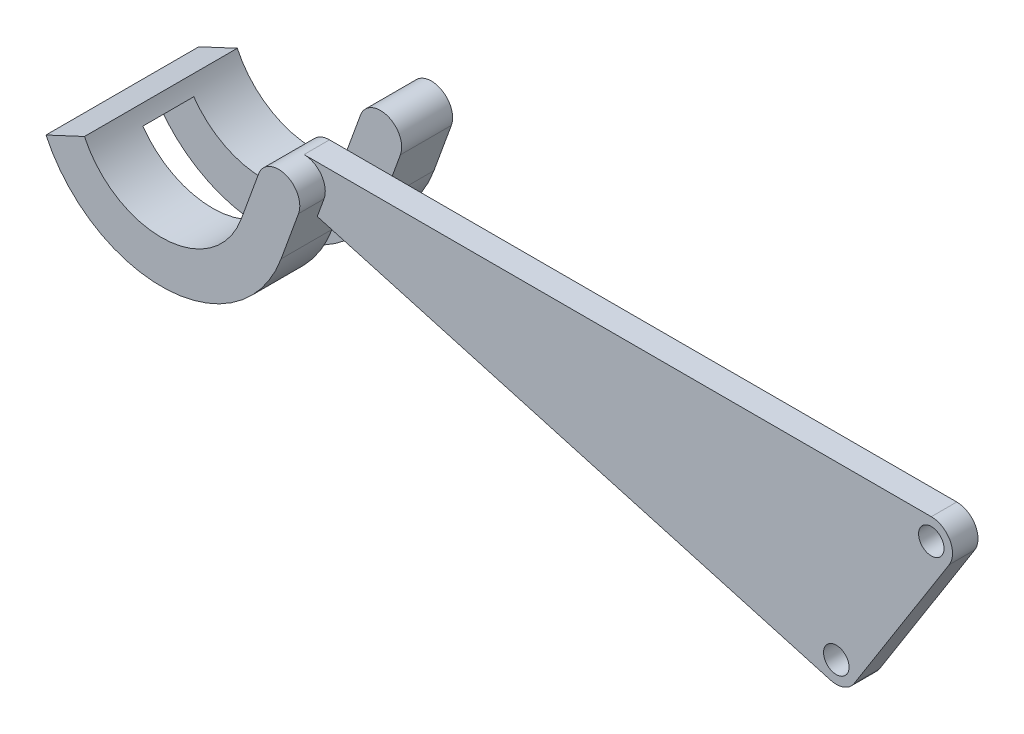
from build123d import *

# Parameters (mm, degrees)
EXTRUDE_1_DEPTH      = 0.75
SKETCH_2_R           = 0.75
CUT_EXTRUDE_1_DEPTH  = 11.5
EXTRUDE_2_DEPTH      = 6
EXTRUDE_2_DEPTH_BACK = 3
CUT_EXTRUDE_2_DEPTH  = 3


with BuildPart() as part:
    # 草圖1 → 填料-伸長1 (new, symmetric)
    with BuildSketch(Plane.XY):
        with BuildLine():
            Line((0, 1.25), (36.94, 1.25))
            ThreePointArc((36.94, 1.25), (38.034878383, 0.603109713), (37.99653086, -0.668013878))
            Line((37.99653086, -0.668013878), (32.401246615, -9.517516363))
            ThreePointArc((32.401246615, -9.517516363), (31.791964157, -10.016750901), (31.005081794, -10.052477452))
            Line((31.005081794, -10.052477452), (-0.339633961, -1.202974968))
            ThreePointArc((-0.339633961, -1.202974968), (-1.238187932, 0.171437001), (0, 1.25))
        make_face()
    extrude(amount=EXTRUDE_1_DEPTH, both=True)

    # 草圖2 → 除料-伸長1 (cut)
    with BuildSketch(Plane.XY.offset(0.75)):
        with Locations((31.344715755, -8.849502484)):
            Circle(SKETCH_2_R)
        with Locations((36.94, 0)):
            Circle(SKETCH_2_R)
        Circle(SKETCH_2_R)
    extrude(amount=-CUT_EXTRUDE_1_DEPTH, mode=Mode.SUBTRACT)

    # 草圖3 → 填料-伸長2 (add, two sides: drawn at the far end of the back side and taken through both)
    with BuildSketch(Plane(origin=(0, 0, -0.75), x_dir=(-1, 0, 0), z_dir=(0, 0, -1)).offset(-EXTRUDE_2_DEPTH_BACK)):
        with BuildLine():
            Line((-1.174615776, -0.427525179), (-0.148555346, -3.246603042))
            ThreePointArc((-0.148555346, -3.246603042), (6.571993905, -8.174313628), (13.696447713, -3.85108893))
            Line((13.696447713, -3.85108893), (11.430678245, -2.794543275))
            ThreePointArc((11.430678245, -2.794543275), (6.681042373, -5.676693074), (2.200676206, -2.391552683))
            Line((2.200676206, -2.391552683), (1.174615776, 0.427525179))
            ThreePointArc((1.174615776, 0.427525179), (-0.427525179, 1.174615776), (-1.174615776, -0.427525179))
        make_face()
    extrude(amount=EXTRUDE_2_DEPTH + EXTRUDE_2_DEPTH_BACK)

    # 草圖4 → 除料-伸長2 (cut)
    with BuildSketch(Plane(origin=(0, 0, -0.75), x_dir=(-1, 0, 0), z_dir=(0, 0, -1))):
        with BuildLine():
            Line((-0.148555346, -3.246603042), (-1.174615776, -0.427525179))
            ThreePointArc((-1.174615776, -0.427525179), (-0.427525179, 1.174615776), (1.174615776, 0.427525179))
            Line((1.174615776, 0.427525179), (2.200676206, -2.391552683))
            ThreePointArc((2.200676206, -2.391552683), (6.246508349, -5.638676273), (10.994899531, -3.549334148))
            Line((10.994899531, -3.549334148), (13.042779642, -4.983275239))
            ThreePointArc((13.042779642, -4.983275239), (5.920192868, -8.117288427), (-0.148555346, -3.246603042))
        make_face()
    extrude(amount=CUT_EXTRUDE_2_DEPTH, mode=Mode.SUBTRACT)


solid = part.part
